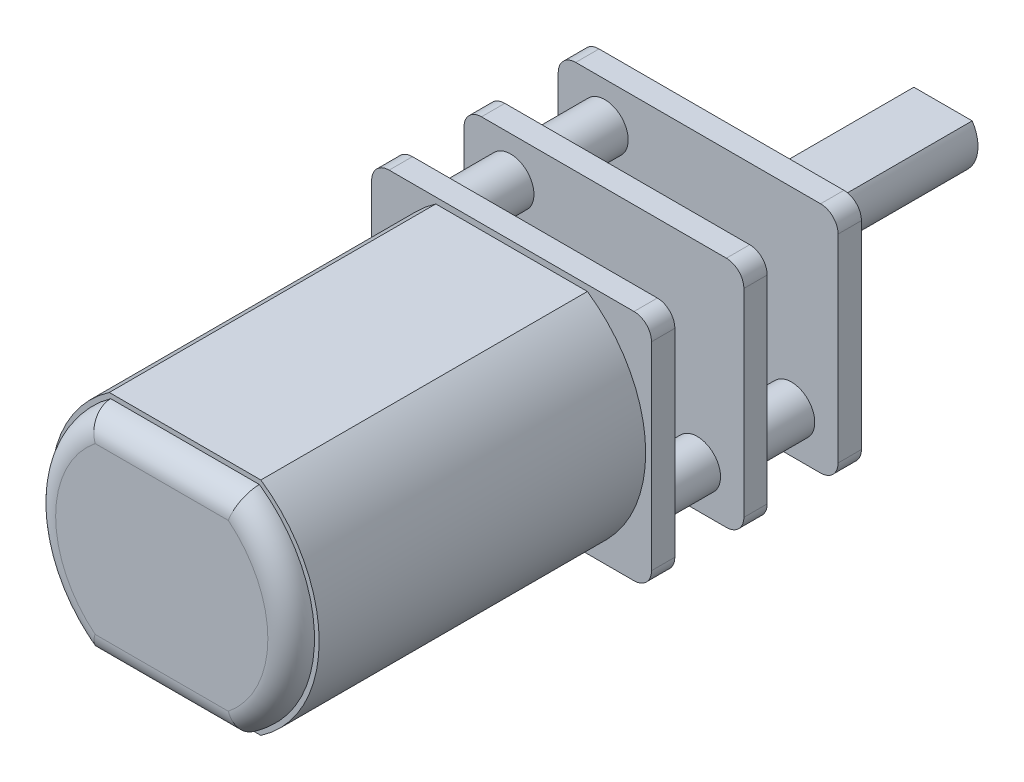
from build123d import *

# Parameters (mm, degrees)
BOSS_EXTRUDE1_DEPTH      = 14
SKETCH2_R                = 1
BOSS_EXTRUDE2_DEPTH      = 9
BOSS_EXTRUDE3_DEPTH      = 6
BOSS_EXTRUDE3_DEPTH_BACK = 6
SKETCH3_W                = 1
SKETCH3_H                = 10
SKETCH4_R                = 2
SKETCH4_R_2              = 1.5
BOSS_EXTRUDE4_DEPTH      = 0.75
SKETCH5_R                = 1.5
BOSS_EXTRUDE5_DEPTH      = 3.5
BOSS_EXTRUDE6_DEPTH      = 6
BOSS_EXTRUDE7_DEPTH      = 1
FILLET1_R                = 1
FILLET2_R                = 0.75


with BuildPart() as part:
    # Sketch1 → Boss-Extrude1 (new body)
    with BuildSketch(Plane.XY):
        with BuildLine():
            Line((3.25, 4.74341649), (-3.25, 4.74341649))
            ThreePointArc((-3.25, 4.74341649), (-5.086747487, 2.680951324), (-5.75, 0))
            Line((-5.75, 0), (5.75, 0))
            ThreePointArc((5.75, 0), (5.086747487, 2.680951324), (3.25, 4.74341649))
        make_face()
        with BuildLine():
            Line((5.75, 0), (-5.75, 0))
            ThreePointArc((-5.75, 0), (-5.086747487, -2.680951324), (-3.25, -4.74341649))
            Line((-3.25, -4.74341649), (3.25, -4.74341649))
            ThreePointArc((3.25, -4.74341649), (5.086747487, -2.680951324), (5.75, 0))
        make_face()
    extrude(amount=BOSS_EXTRUDE1_DEPTH)

    # Sketch2 → Boss-Extrude2 (add)
    with BuildSketch(Plane.XY):
        with Locations((4, -3.24341649)):
            Circle(SKETCH2_R)
        with Locations((-4, 3.24341649)):
            Circle(SKETCH2_R)
    extrude(amount=-BOSS_EXTRUDE2_DEPTH)

    # Sketch3 → Boss-Extrude3 (add, two sides: drawn at the far end of the back side and taken through both)
    with BuildSketch(Plane(origin=(0, 0, 0), x_dir=(0, 0, -1), z_dir=(1, 0, 0)).offset(-BOSS_EXTRUDE3_DEPTH_BACK)):
        with Locations((0.5, 0)):
            Rectangle(SKETCH3_W, SKETCH3_H)
        with Locations((4.459742397, 0)):
            Rectangle(SKETCH3_W, SKETCH3_H)
        with Locations((8.5, 0)):
            Rectangle(SKETCH3_W, SKETCH3_H)
    extrude(amount=BOSS_EXTRUDE3_DEPTH + BOSS_EXTRUDE3_DEPTH_BACK)

    # Sketch4 → Boss-Extrude4 (add)
    with BuildSketch(Plane(origin=(0, 0, -9), x_dir=(-1, 0, 0), z_dir=(0, 0, -1))):
        with Locations(Location((0, 0, 0), (0, 0, 180))):
            Circle(SKETCH4_R)
        Circle(SKETCH4_R_2, mode=Mode.SUBTRACT)
    extrude(amount=BOSS_EXTRUDE4_DEPTH)

    # Sketch5 → Boss-Extrude5 (add)
    with BuildSketch(Plane(origin=(0, 0, -9), x_dir=(-1, 0, 0), z_dir=(0, 0, -1))):
        Circle(SKETCH5_R)
    extrude(amount=BOSS_EXTRUDE5_DEPTH)

    # Sketch6 → Boss-Extrude6 (add)
    with BuildSketch(Plane(origin=(0, 0, -12.5), x_dir=(-1, 0, 0), z_dir=(0, 0, -1))):
        with BuildLine():
            Line((1.25, 0.829156198), (-1.25, 0.829156198))
            ThreePointArc((-1.25, 0.829156198), (-0.433012702, -1.436140662), (1.5, 0))
            ThreePointArc((1.5, 0), (1.436140662, 0.433012702), (1.25, 0.829156198))
        make_face()
    extrude(amount=BOSS_EXTRUDE6_DEPTH)

    # Sketch7 → Boss-Extrude7 (add)
    with BuildSketch(Plane.XY.offset(14)):
        with BuildLine():
            Line((-3.187454564, -4.54341649), (3.187454564, -4.54341649))
            ThreePointArc((3.187454564, -4.54341649), (5.55, 0), (3.187454564, 4.54341649))
            Line((3.187454564, 4.54341649), (-3.187454564, 4.54341649))
            ThreePointArc((-3.187454564, 4.54341649), (-5.55, 0), (-3.187454564, -4.54341649))
        make_face()
    extrude(amount=BOSS_EXTRUDE7_DEPTH)

    # Fillet1
    fillet1_edges = [part.edges().sort_by_distance(p)[0] for p in [
        (0, 4.54341649, 15),
        (5.55, 0, 15),
        (0, -4.54341649, 15),
        (-5.55, 0, 15),
    ]]
    fillet(fillet1_edges, radius=FILLET1_R - 0.0001)  # a hair under: the kernel refuses the full size

    # Fillet2
    fillet2_edges = [part.edges().sort_by_distance(p)[0] for p in [
        (-6, 5, -0.5),
        (-6, -5, -0.5),
        (6, -5, -0.5),
        (6, 5, -0.5),
        (-6, 5, -4.459742397),
        (-6, -5, -4.459742397),
        (6, -5, -4.459742397),
        (6, 5, -4.459742397),
        (-6, -5, -8.5),
        (-6, 5, -8.5),
        (6, 5, -8.5),
        (6, -5, -8.5),
    ]]
    fillet(fillet2_edges, radius=FILLET2_R)


solid = part.part
